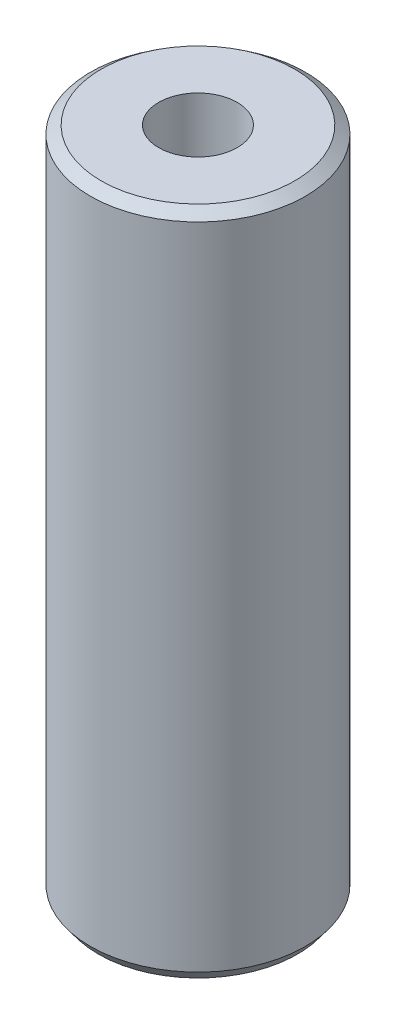
from build123d import *
from OCP.BRepFilletAPI import BRepFilletAPI_MakeChamfer

# Parameters (mm, degrees)
SKETCH1_R           = 52.5
BOSS_EXTRUDE1_DEPTH = 326.358720243
SKETCH2_R           = 19.174131104
CUT_EXTRUDE1_DEPTH  = 335.697646061
CHAMFER1_SIZE       = 3.891469525
CHAMFER1_SIZE2      = 5.232430728


with BuildPart() as part:
    # Sketch1 → Boss-Extrude1 (new body)
    with BuildSketch(Plane(origin=(0, 0, 0), x_dir=(1, 0, 0), z_dir=(0, 1, 0))):
        Circle(SKETCH1_R)
    extrude(amount=BOSS_EXTRUDE1_DEPTH)

    # Sketch2 → Cut-Extrude1 (cut, through all)
    with BuildSketch(Plane(origin=(0, 0, 0), x_dir=(1, 0, 0), z_dir=(0, 1, 0))):
        Circle(SKETCH2_R)
    extrude(amount=CUT_EXTRUDE1_DEPTH, mode=Mode.SUBTRACT)

    # Chamfer1: one chamfer whose edges measure the first distance from different faces: ONE call of the kernel's chamfer builder (chamfer() names one face for all edges)
    chamfer1_edges_1 = [part.edges().sort_by_distance(p)[0] for p in [
        (-52.5, 326.358720243, 0),
    ]]
    chamfer1_side_1 = [part.faces().sort_by_distance(p)[0] for p in [
        (-52.5, 163.179360121, 0),
    ]]
    chamfer1_edges_2 = [part.edges().sort_by_distance(p)[0] for p in [
        (-52.5, 0, 0),
    ]]
    chamfer1_side_2 = [part.faces().sort_by_distance(p)[0] for p in [
        (-51.01507576, 0, 0),
    ]]
    chamfer1 = BRepFilletAPI_MakeChamfer(part.part.solid().wrapped)
    for e in chamfer1_edges_1:
        chamfer1.Add(CHAMFER1_SIZE, CHAMFER1_SIZE2, e.wrapped, chamfer1_side_1[0].wrapped)  # the first distance lies on this face
    for e in chamfer1_edges_2:
        chamfer1.Add(CHAMFER1_SIZE, CHAMFER1_SIZE2, e.wrapped, chamfer1_side_2[0].wrapped)  # the first distance lies on this face
    add(Compound.cast(chamfer1.Shape()), mode=Mode.REPLACE)


solid = part.part
